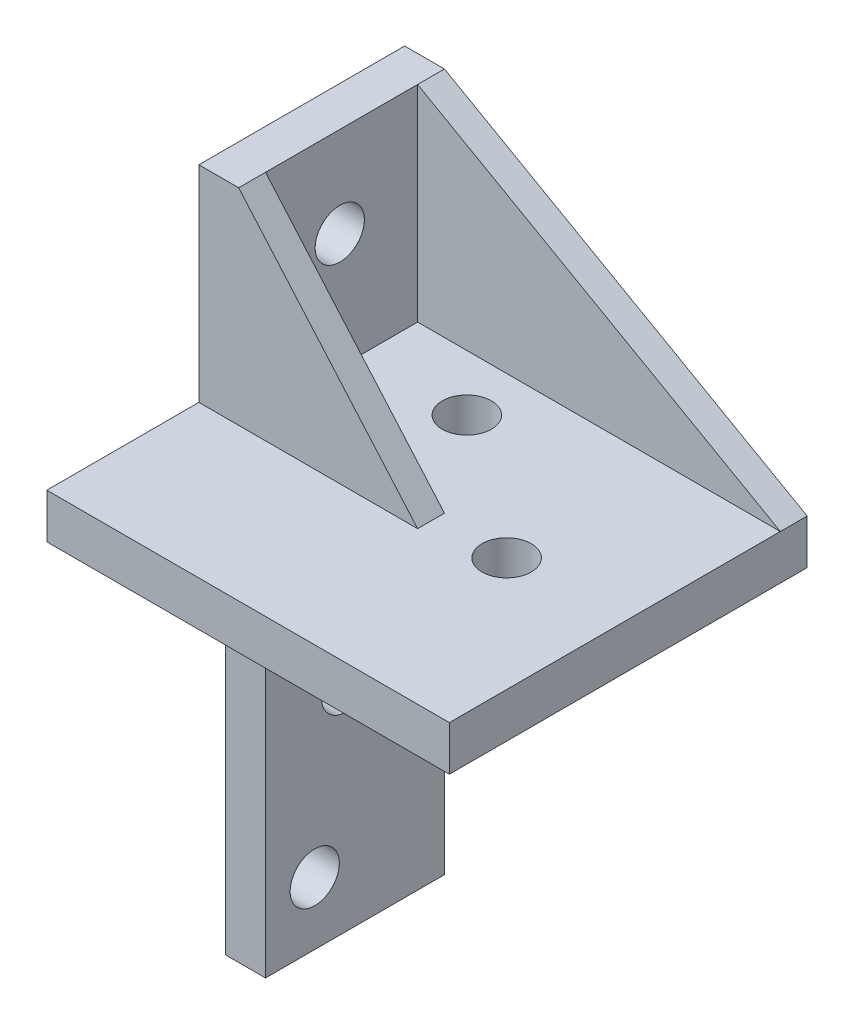
from build123d import *

# Parameters (mm, degrees)
SKETCH1_W           = 20
SKETCH1_H           = 50
BOSS_EXTRUDE1_DEPTH = 4.45
SKETCH2_W           = 45
SKETCH2_H           = 40
BOSS_EXTRUDE2_DEPTH = 5
CUT_EXTRUDE1_REACH  = 75.824
SKETCH4_R           = 2.75
SKETCH5_R           = 2.75
CUT_EXTRUDE2_DEPTH  = 72.199034404
SKETCH6_W           = 4.45
SKETCH6_H           = 20
BOSS_EXTRUDE3_DEPTH = 23
SKETCH7_R           = 2.75
CUT_EXTRUDE3_DEPTH  = 91.157098999
BOSS_EXTRUDE4_DEPTH = 3
BOSS_EXTRUDE5_DEPTH = 3


with BuildPart() as part:
    # Sketch1 → Boss-Extrude1 (new body)
    with BuildSketch(Plane(origin=(0, 0, 0), x_dir=(0, 0, -1), z_dir=(1, 0, 0))):
        with Locations((10, 25)):
            Rectangle(SKETCH1_W, SKETCH1_H)
    extrude(amount=BOSS_EXTRUDE1_DEPTH)

    # Sketch2 → Boss-Extrude2 (add)
    with BuildSketch(Plane(origin=(0, 50, 0), x_dir=(1, 0, 0), z_dir=(0, 1, 0))):
        with Locations((22.5, 0)):
            Rectangle(SKETCH2_W, SKETCH2_H)
    extrude(amount=BOSS_EXTRUDE2_DEPTH)

    # Sketch4 → Cut-Extrude1 (cut, up to next)
    with BuildSketch(Plane(origin=(0, 55, 0), x_dir=(1, 0, 0), z_dir=(0, 1, 0)), mode=Mode.PRIVATE) as cut_extrude1_sk1:
        with Locations((32.25, -0.85)):
            Circle(SKETCH4_R)
    cut_extrude1_tool1 = extrude(cut_extrude1_sk1.sketch, amount=-CUT_EXTRUDE1_REACH, mode=Mode.PRIVATE) & part.part
    # Sketch4 → Cut-Extrude1 (cut, up to next)
    with BuildSketch(Plane(origin=(0, 55, 0), x_dir=(1, 0, 0), z_dir=(0, 1, 0)), mode=Mode.PRIVATE) as cut_extrude1_sk2:
        with Locations((16.2, 10.75)):
            Circle(SKETCH4_R)
    cut_extrude1_tool2 = extrude(cut_extrude1_sk2.sketch, amount=-CUT_EXTRUDE1_REACH, mode=Mode.PRIVATE) & part.part
    add(cut_extrude1_tool1.solids().sort_by_distance((32.25, 55, 0.85))[0], mode=Mode.SUBTRACT)
    add(cut_extrude1_tool2.solids().sort_by_distance((16.2, 55, -10.75))[0], mode=Mode.SUBTRACT)

    # Sketch5 → Cut-Extrude2 (cut, through all)
    with BuildSketch(Plane(origin=(4.45, 0, 0), x_dir=(0, 0, -1), z_dir=(1, 0, 0))):
        with Locations((9, 24)):
            Circle(SKETCH5_R)
        with Locations((5.5, 7)):
            Circle(SKETCH5_R)
    extrude(amount=-CUT_EXTRUDE2_DEPTH, mode=Mode.SUBTRACT)

    # Sketch6 → Boss-Extrude3 (add)
    with BuildSketch(Plane(origin=(0, 55, 0), x_dir=(1, 0, 0), z_dir=(0, 1, 0))):
        with Locations((2.225, 10)):
            Rectangle(SKETCH6_W, SKETCH6_H)
    extrude(amount=BOSS_EXTRUDE3_DEPTH)

    # Sketch7 → Cut-Extrude3 (cut, through all)
    with BuildSketch(Plane(origin=(4.45, 0, 0), x_dir=(0, 0, -1), z_dir=(1, 0, 0))):
        with Locations((8.3, 67.9)):
            Circle(SKETCH7_R)
    extrude(amount=-CUT_EXTRUDE3_DEPTH, mode=Mode.SUBTRACT)

    # Sketch8 → Boss-Extrude4 (add)
    with BuildSketch(Plane(origin=(0, 0, -20), x_dir=(-1, 0, 0), z_dir=(0, 0, -1))):
        Polygon((-4.45, 78), (-4.45, 55), (-45, 55), align=None)
    extrude(amount=-BOSS_EXTRUDE4_DEPTH)

    # Sketch9 → Boss-Extrude5 (add)
    with BuildSketch(Plane.XY):
        Polygon((4.45, 55), (24.45, 55), (4.45, 78), (0, 78), (0, 55), align=None)
    extrude(amount=BOSS_EXTRUDE5_DEPTH)


solid = part.part
